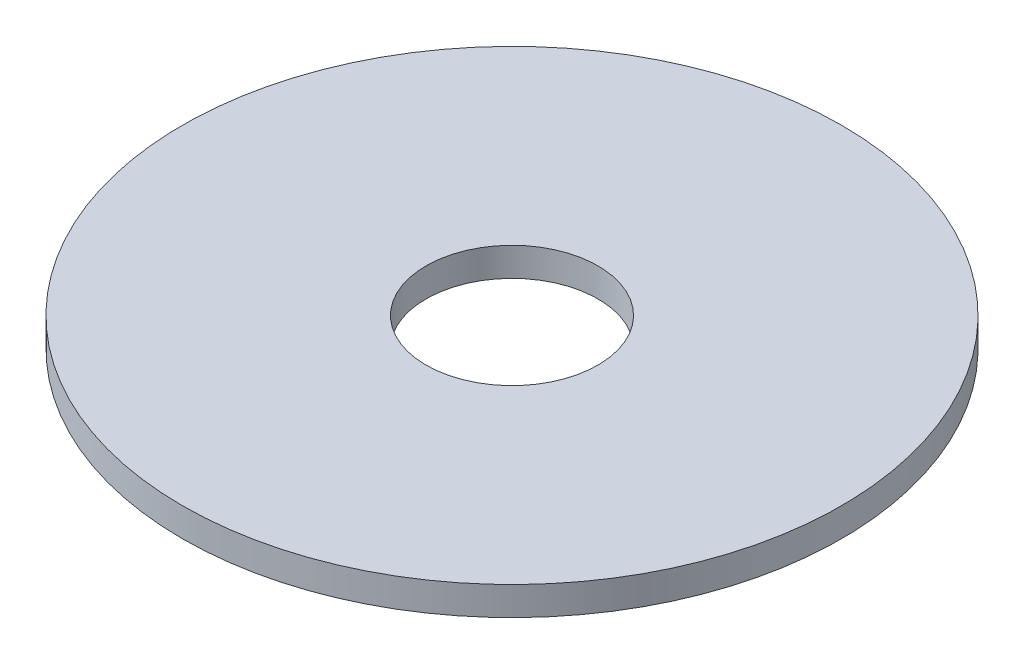
from build123d import *

# Parameters (mm, degrees)
SKETCH1_R           = 14.605
SKETCH1_R_2         = 3.81
BOSS_EXTRUDE1_DEPTH = 1.27


with BuildPart() as part:
    # Sketch1 → Boss-Extrude1 (new body)
    with BuildSketch(Plane(origin=(0, 0, 0), x_dir=(1, 0, 0), z_dir=(0, 1, 0))):
        Circle(SKETCH1_R)
        Circle(SKETCH1_R_2, mode=Mode.SUBTRACT)
    extrude(amount=BOSS_EXTRUDE1_DEPTH)


solid = part.part
